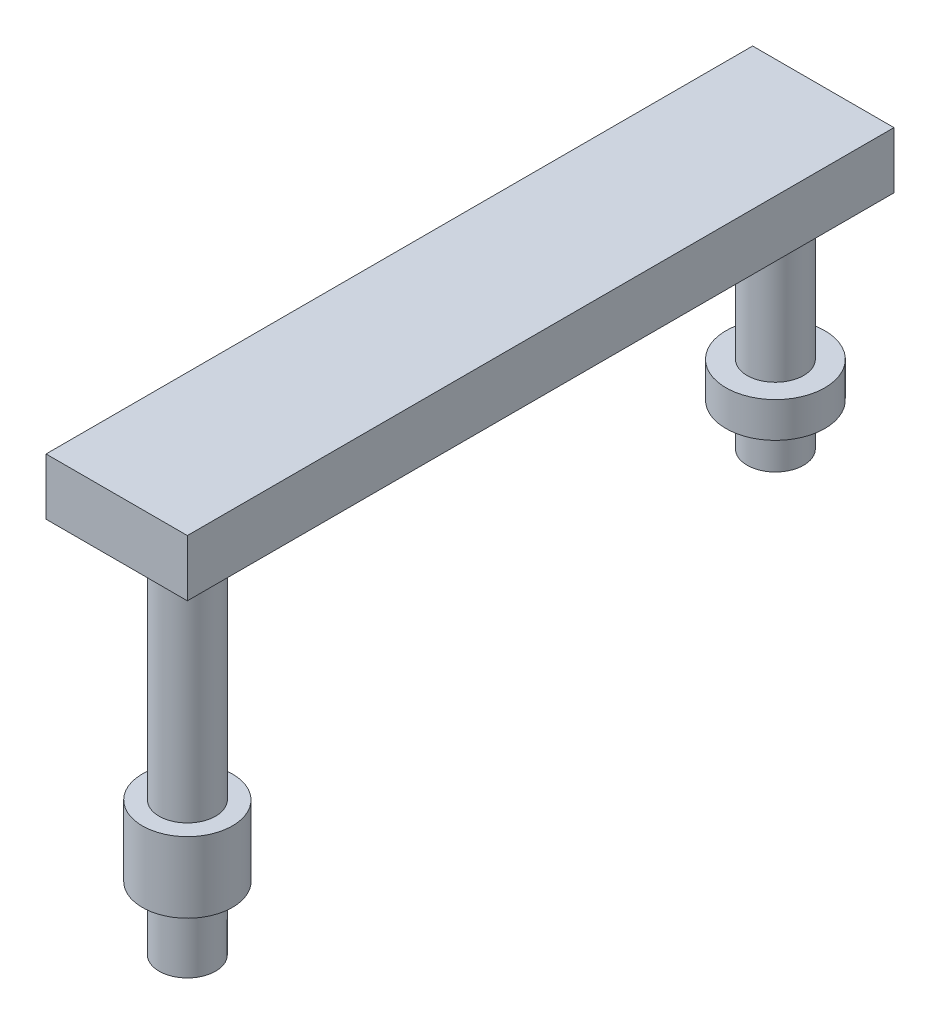
from build123d import *

# Parameters (mm, degrees)
SKETCH2_R           = 5.08
BOSS_EXTRUDE2_DEPTH = 41.91
SKETCH3_W           = 8.89
SKETCH3_H           = 6.35
SKETCH7_R           = 0.010126349
CUT_EXTRUDE2_DEPTH  = 20.32
SKETCH8_W           = 25.4
SKETCH8_H           = 127
BOSS_EXTRUDE3_DEPTH = 10.16
SKETCH9_R           = 5.08
BOSS_EXTRUDE4_DEPTH = 67.818
BOSS_EXTRUDE5_START = -11.43
SKETCH10_R          = 8.093598109
BOSS_EXTRUDE5_DEPTH = 12.7


with BuildPart() as part:
    # Sketch2 → Boss-Extrude2 (new body)
    with BuildSketch(Plane(origin=(0, 0, 0), x_dir=(-1, 0, 0), z_dir=(0, 1, 0))):
        Circle(SKETCH2_R)
    extrude(amount=BOSS_EXTRUDE2_DEPTH)

    # Sketch3 → Revolve1 (revolve)
    with BuildSketch(Plane.XY):
        with Locations((-4.445, 10.795)):
            Rectangle(SKETCH3_W, SKETCH3_H)
    revolve(axis=Axis((0, 0, 0), (0, 1, 0)))

    # Sketch7 → Cut-Extrude2 (cut)
    with BuildSketch(Plane.XZ):
        with BuildLine():
            ThreePointArc((2.641406414, 0.011252079), (-2.146329519, 1.675427813), (0.577013349, -2.599534158))
            Line((0.577013349, -2.599534158), (2.62910726, -0.245357181))
            ThreePointArc((2.62910726, -0.245357181), (2.638329861, -0.117199839), (2.641406414, 0.011252079))
        make_face()
        with Locations((-1.945282447, 1.696833234)):
            Circle(SKETCH7_R, mode=Mode.SUBTRACT)
    extrude(amount=-CUT_EXTRUDE2_DEPTH, mode=Mode.SUBTRACT)

    # Sketch8 → Boss-Extrude3 (add)
    with BuildSketch(Plane(origin=(0, 41.91, 0), x_dir=(1, 0, 0), z_dir=(0, 1, 0))):
        with Locations((0, -54.888880417)):
            Rectangle(SKETCH8_W, SKETCH8_H)
    extrude(amount=BOSS_EXTRUDE3_DEPTH)

    # Sketch9 → Boss-Extrude4 (add)
    with BuildSketch(Plane.XZ.offset(-41.91)):
        with Locations((0, 105.688880417)):
            Circle(SKETCH9_R)
        with BuildLine():
            Line((2.663781294, 105.933613372), (0.813312495, 103.140518632))
            ThreePointArc((0.813312495, 103.140518632), (-2.229997726, 107.166288668), (2.663781294, 105.933613372))
        make_face(mode=Mode.SUBTRACT)
    extrude(amount=BOSS_EXTRUDE4_DEPTH)

    # Sketch10 → Boss-Extrude5 (add)
    with BuildSketch(Plane.XZ.offset(25.908).offset(BOSS_EXTRUDE5_START)):
        with Locations((0, 105.688880417)):
            Circle(SKETCH10_R)
    extrude(amount=-BOSS_EXTRUDE5_DEPTH)


solid = part.part
